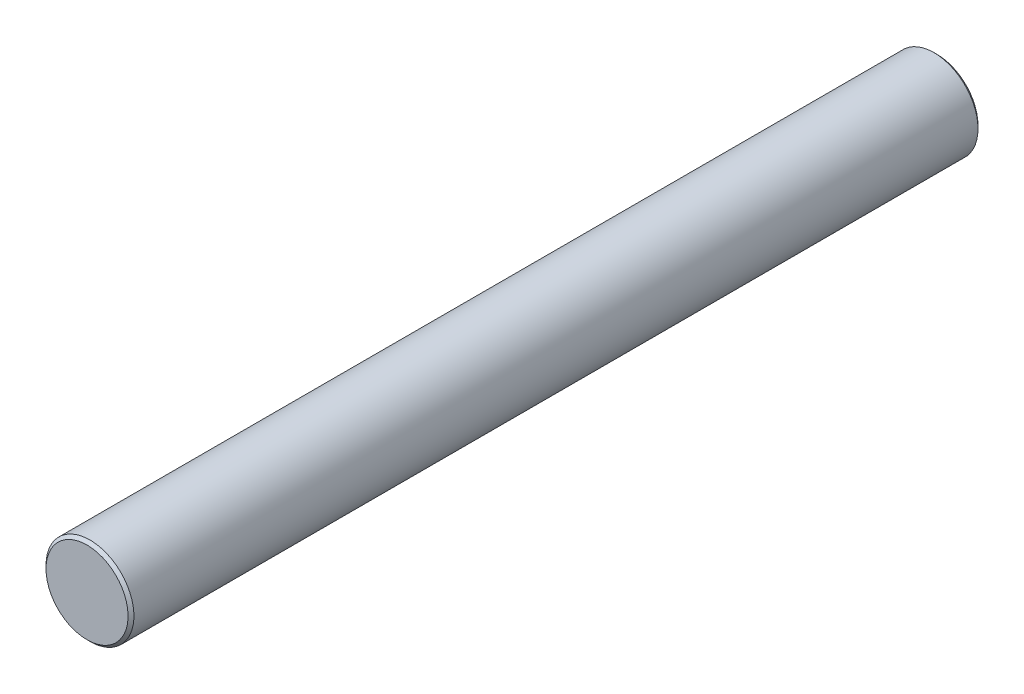
from build123d import *

# Parameters (mm, degrees)
SKETCH2_R           = 0.75
BOSS_EXTRUDE1_DEPTH = 14.5
CHAMFER2_SIZE       = 0.05


with BuildPart() as part:
    # Sketch2 → Boss-Extrude1 (new body)
    with BuildSketch(Plane.XY):
        Circle(SKETCH2_R)
    extrude(amount=BOSS_EXTRUDE1_DEPTH)

    # Chamfer2
    chamfer2_edges = [part.edges().sort_by_distance(p)[0] for p in [
        (-0.75, 0, 14.5),
        (-0.75, 0, 0),
    ]]
    chamfer(chamfer2_edges, length=CHAMFER2_SIZE)


solid = part.part
